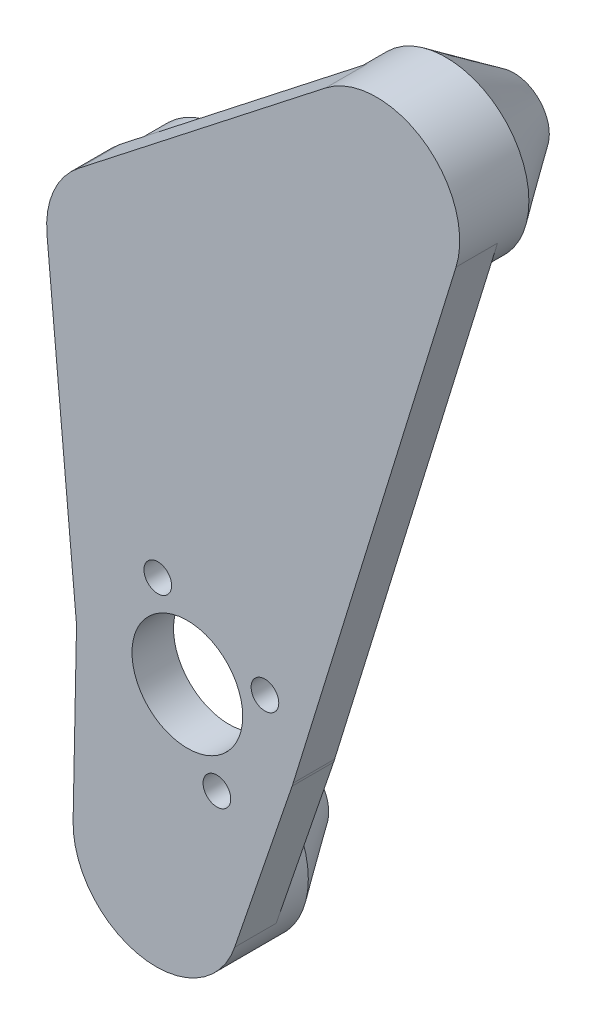
from build123d import *
from build123d.topology import SkipClean

# Parameters (mm, degrees)
BOSS_EXTRUDE1_DEPTH = 3
BOSS_EXTRUDE2_DEPTH = 3
SKETCH3_R           = 4
CUT_EXTRUDE1_DEPTH  = 50
SKETCH4_R           = 1
CUT_EXTRUDE2_DEPTH  = 10
BOSS_EXTRUDE3_START = -7
SKETCH1_4_R         = 6
BOSS_EXTRUDE3_DEPTH = 7
BOSS_EXTRUDE4_START = -7
SKETCH2_4_R         = 6
BOSS_EXTRUDE4_DEPTH = 7
CHAMFER1_SIZE       = 5
CHAMFER1_SIZE_2     = 3.501037691


with BuildPart() as part:
    # Sketch1 → Boss-Extrude1 (new body)
    with BuildSketch(Plane.XY):
        with BuildLine():
            ThreePointArc((-7.862783113, 28.36246747), (-9.674812704, 26.016588816), (-10.142674299, 23.089524856))
            Line((-10.142674299, 23.089524856), (-7.966824047, -0.727814955))
            ThreePointArc((-7.966824047, -0.727814955), (-0.830270862, -7.956798998), (7.644946217, -2.356861757))
            Line((7.644946217, -2.356861757), (19.414515396, 35.820058514))
            ThreePointArc((19.414515396, 35.820058514), (17.084366379, 42.528936958), (9.985578884, 42.314786229))
            Line((9.985578884, 42.314786229), (-7.862783113, 28.36246747))
        make_face()
    extrude(amount=BOSS_EXTRUDE1_DEPTH)

    # Sketch2 → Boss-Extrude2 (add)
    with BuildSketch(Plane.XY):
        with BuildLine():
            Line((-7.9983883, 0.16057583), (-8.256217535, -12.682068917))
            ThreePointArc((-8.256217535, -12.682068917), (-3.299315376, -18.711347307), (3.420783665, -14.741039282))
            Line((3.420783665, -14.741039282), (7.570946632, -2.584717991))
            ThreePointArc((7.570946632, -2.584717991), (-1.389185421, -7.878462024), (-7.9983883, 0.16057583))
        make_face()
    extrude(amount=BOSS_EXTRUDE2_DEPTH)

    # Sketch3 → Cut-Extrude1 (cut)
    with BuildSketch(Plane.XY.offset(3)):
        Circle(SKETCH3_R)
    extrude(amount=-CUT_EXTRUDE1_DEPTH, mode=Mode.SUBTRACT)

    # Sketch4 → Cut-Extrude2 (cut)
    with BuildSketch(Plane.XY.offset(3)):
        with Locations((2.135535698, -5.607092587)):
            Circle(SKETCH4_R)
        with Locations((-2.135535698, 5.607092587)):
            Circle(SKETCH4_R)
        with Locations((5.607092587, 2.135535698)):
            Circle(SKETCH4_R)
    extrude(amount=-CUT_EXTRUDE2_DEPTH, mode=Mode.SUBTRACT)

    # Sketch1<4> → Boss-Extrude3 (add)
    with SkipClean():  # the faces are left unmerged after this step: merging them gives an invalid solid
        with BuildSketch(Plane.XY.offset(BOSS_EXTRUDE3_START)):
            with Locations(Location((13.680805733, 37.587704831, 0), (0, 0, 128.01524628))):
                Circle(SKETCH1_4_R)
            with Locations((-2.167556264, 25.198814555)):
                Circle(SKETCH1_4_R)
        extrude(amount=BOSS_EXTRUDE3_DEPTH)

    # Sketch2<4> → Boss-Extrude4 (add)
    with SkipClean():  # the faces are left unmerged after this step: merging them gives an invalid solid
        with BuildSketch(Plane.XY.offset(BOSS_EXTRUDE4_START)):
            with Locations(Location((-2.25742631, -12.802500789, 0), (0, 0, 178.849883098))):
                Circle(SKETCH2_4_R)
        extrude(amount=BOSS_EXTRUDE4_DEPTH)

    # Sketch5 one side → Cut-Revolve1 (revolve, cut)
    with SkipClean():  # the faces are left unmerged after this step: merging them gives an invalid solid
        with BuildSketch(Plane(origin=(13.680805733, 0, 0), x_dir=(0, 0, -1), z_dir=(1, 0, 0))):
            with BuildLine():
                ThreePointArc((10, 33.587704831), (12.828427125, 34.759277707), (14, 37.587704831))
                ThreePointArc((14, 37.587704831), (12.828427125, 40.416131956), (10, 41.587704831))
                Line((10, 41.587704831), (10, 33.587704831))
            make_face()
        revolve(axis=Axis((13.680805733, 41.587704831, -10), (0, -1, 0)), mode=Mode.SUBTRACT)

    # Sketch6 → Cut-Revolve2 (revolve, cut)
    with SkipClean():  # the faces are left unmerged after this step: merging them gives an invalid solid
        with BuildSketch(Plane(origin=(-2.167556264, 0, 0), x_dir=(0, 0, -1), z_dir=(1, 0, 0))):
            with BuildLine():
                ThreePointArc((14, 25.198814555), (12.828427125, 28.02724168), (10, 29.198814555))
                Line((10, 29.198814555), (10, 21.198814555))
                ThreePointArc((10, 21.198814555), (12.828427125, 22.37038743), (14, 25.198814555))
            make_face()
            with BuildLine():
                Line((10, 21.198814555), (10, 29.198814555))
                ThreePointArc((10, 29.198814555), (6, 25.198814555), (10, 21.198814555))
            make_face()
        revolve(axis=Axis((-2.167556264, 29.198814555, -10), (0, -1, 0)), mode=Mode.SUBTRACT)

    # Sketch7 → Cut-Revolve3 (revolve, cut)
    with SkipClean():  # the faces are left unmerged after this step: merging them gives an invalid solid
        with BuildSketch(Plane(origin=(-2.25742631, 0, 0), x_dir=(0, 0, -1), z_dir=(1, 0, 0))):
            with BuildLine():
                ThreePointArc((14, -12.802500789), (12.828427125, -9.974073664), (10, -8.802500789))
                Line((10, -8.802500789), (10, -16.802500789))
                ThreePointArc((10, -16.802500789), (12.828427125, -15.630927914), (14, -12.802500789))
            make_face()
            with BuildLine():
                Line((10, -16.802500789), (10, -8.802500789))
                ThreePointArc((10, -8.802500789), (6, -12.802500789), (10, -16.802500789))
            make_face()
        revolve(axis=Axis((-2.25742631, -8.802500789, -10), (0, -1, 0)), mode=Mode.SUBTRACT)

    # Chamfer1
    # the kernel refuses this chamfer: 5, 3.501037691 mm, written as the material it takes off along each edge
    with BuildSketch(Plane(origin=(-2.25742631, -12.802500789, -7), x_dir=(-0.9997985375420249, 0.020071978697384193, 0), z_dir=(0.020071978697384193, 0.9997985375420249, 0))) as chamfer1_piece_1:
        Polygon((6, CHAMFER1_SIZE), (6 - CHAMFER1_SIZE_2, 0), (6, 0), align=None)
    revolve(axis=Axis((-2.25742631, -12.802500789, -7), (0, 0, 1)), mode=Mode.SUBTRACT)
    with BuildSketch(Plane(origin=(13.680805733, 37.587704831, -7), x_dir=(-0.615871141442135, 0.7878468995552129, 0), z_dir=(0.7878468995552129, 0.615871141442135, 0))) as chamfer1_piece_2:
        Polygon((6, CHAMFER1_SIZE), (6 - CHAMFER1_SIZE_2, 0), (6, 0), align=None)
    revolve(axis=Axis((13.680805733, 37.587704831, -7), (0, 0, 1)), mode=Mode.SUBTRACT)
    with BuildSketch(Plane(origin=(-2.167556264, 25.198814555, -7), x_dir=(1, 0, 0), z_dir=(0, -1, 0))) as chamfer1_piece_3:
        Polygon((6, CHAMFER1_SIZE), (6 - CHAMFER1_SIZE_2, 0), (6, 0), align=None)
    revolve(axis=Axis((-2.167556264, 25.198814555, -7), (0, 0, 1)), mode=Mode.SUBTRACT)


solid = part.part
